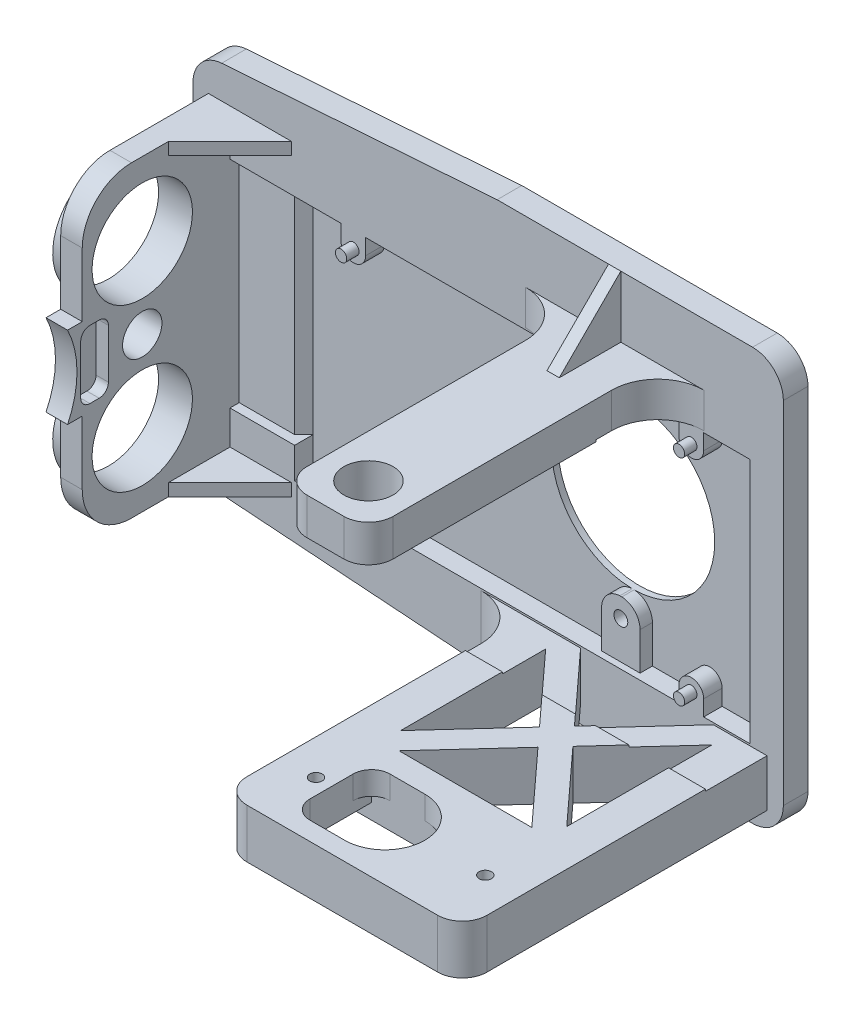
from build123d import *

# Parameters (mm, degrees)
BOSS_EXTRUDE1_START      = 1
SKETCH2_W                = 95.9
SKETCH2_H                = 67
BOSS_EXTRUDE1_DEPTH      = 4
SKETCH3_W                = 14
SKETCH3_H                = 6
BOSS_EXTRUDE2_DEPTH      = 47
SKETCH4_R                = 4
CUT_EXTRUDE1_DEPTH       = 6
SKETCH5_W                = 39
SKETCH5_H                = 8
BOSS_EXTRUDE3_DEPTH      = 49.5
SKETCH6_W                = 32.5
SKETCH6_H                = 13
CUT_EXTRUDE2_DEPTH       = 2.5
SKETCH7_W                = 22.5
SKETCH7_H                = 13
CUT_EXTRUDE3_DEPTH       = 1.75
SKETCH10_R               = 1
CUT_EXTRUDE5_DEPTH       = 5.5
FILLET1_R                = 4
SKETCH16_W               = 3.5
SKETCH16_H               = 50
BOSS_EXTRUDE5_DEPTH      = 24
BOSS_EXTRUDE6_DEPTH      = 3.5
SKETCH18_R               = 8.15
SKETCH18_R_2             = 3.2
CUT_EXTRUDE8_DEPTH       = 3.5
SKETCH19_W               = 4.5
SKETCH19_H               = 11
CUT_EXTRUDE9_DEPTH       = 2
BOSS_EXTRUDE7_START      = -5.5
SKETCH20_R               = 9.05
SKETCH20_R_2             = 8.15
SKETCH20_R_3             = 4.1
SKETCH20_R_4             = 3.2
BOSS_EXTRUDE7_DEPTH      = 5.5
FILLET2_R                = 8
CUT_EXTRUDE10_DEPTH      = 4
FILLET4_R                = 5
SKETCH23_W               = 74
SKETCH23_H               = 40
CUT_EXTRUDE12_DEPTH      = 3
SKETCH43_W               = 10.5
SKETCH43_H               = 35
CUT_EXTRUDE19_DEPTH      = 1.5
CUT_EXTRUDE20_REACH      = 115.084
SKETCH45_W               = 10
SKETCH45_H               = 40.6
SKETCH24_W               = 15.15
SKETCH24_H               = 13
CUT_EXTRUDE13_DEPTH      = 3.75
FILLET6_R                = 7.5
FILLET7_R                = 1.5
FILLET8_R                = 6.5
CUT_EXTRUDE15_DEPTH      = 10
BOSS_EXTRUDE9_DEPTH      = 3.75
BOSS_EXTRUDE10_DEPTH     = 2
SKETCH34_W               = 2
SKETCH34_H               = 10
BOSS_EXTRUDE11_DEPTH     = 10
CUT_EXTRUDE16_DEPTH      = 2
BOSS_EXTRUDE12_DEPTH     = 3
SKETCH37_R               = 0.92
BOSS_EXTRUDE13_DEPTH     = 2
SKETCH40_R               = 13.25
CUT_EXTRUDE17_DEPTH      = 1
SKETCH42_R               = 1.125
CUT_EXTRUDE18_DEPTH      = 1
CHAMFER1_SIZE            = 1.5
BOSS_EXTRUDE15_OUTLINE_R = 1.125
BOSS_EXTRUDE15_DEPTH     = 2


# Read off the part's stored shape, not the designer's step: Boss-Extrude15
# Some blends are built 0.0001 mm under size
with BuildPart() as part:
    # Sketch2 → Boss-Extrude1 (new body)
    with BuildSketch(Plane.XY.offset(BOSS_EXTRUDE1_START)):
        with Locations((-20.55, 0)):
            Rectangle(SKETCH2_W, SKETCH2_H)
    extrude(amount=BOSS_EXTRUDE1_DEPTH)

    # Sketch3 → Boss-Extrude2 (add)
    with BuildSketch(Plane.XY.offset(5)):
        with Locations((0, 20.5)):
            Rectangle(SKETCH3_W, SKETCH3_H)
    extrude(amount=BOSS_EXTRUDE2_DEPTH)

    # Sketch4 → Cut-Extrude1 (cut)
    with BuildSketch(Plane(origin=(0, 17.5, 0), x_dir=(-1, 0, 0), z_dir=(0, -1, 0))):
        with Locations(Location((0, -45, 0), (0, 0, 90))):
            Circle(SKETCH4_R)
    extrude(amount=-CUT_EXTRUDE1_DEPTH, mode=Mode.SUBTRACT)

    # Sketch5 → Boss-Extrude3 (add)
    with BuildSketch(Plane.XY.offset(5)):
        with Locations((5.25, -26.5)):
            Rectangle(SKETCH5_W, SKETCH5_H)
    extrude(amount=BOSS_EXTRUDE3_DEPTH)

    # Sketch6 → Cut-Extrude2 (cut)
    with BuildSketch(Plane.XZ.offset(30.5)):
        with Locations((5.25, 45)):
            Rectangle(SKETCH6_W, SKETCH6_H)
    extrude(amount=-CUT_EXTRUDE2_DEPTH, mode=Mode.SUBTRACT)

    # Sketch7 → Cut-Extrude3 (cut)
    with BuildSketch(Plane.XZ.offset(28)):
        with Locations((5.25, 45)):
            Rectangle(SKETCH7_W, SKETCH7_H)
    extrude(amount=-CUT_EXTRUDE3_DEPTH, mode=Mode.SUBTRACT)

    # Sketch10 → Cut-Extrude5 (cut)
    with BuildSketch(Plane.XZ.offset(28)):
        with Locations(Location((-8.525, 45, 0), (0, 0, 270))):
            Circle(SKETCH10_R)
        with Locations(Location((18.975, 45, 0), (0, 0, 270))):
            Circle(SKETCH10_R)
    extrude(amount=-CUT_EXTRUDE5_DEPTH, mode=Mode.SUBTRACT)

    # Fillet1
    fillet1_edges = [part.edges().sort_by_distance(p)[0] for p in [
        (7, 20.5, 52),
        (-7, 20.5, 52),
        (24.75, -26.5, 54.5),
        (-14.25, -26.5, 54.5),
    ]]
    fillet(fillet1_edges, radius=FILLET1_R)

    # Sketch16 → Boss-Extrude5 (add)
    with BuildSketch(Plane.XY.offset(5)):
        with Locations((-64.25, 0)):
            Rectangle(SKETCH16_W, SKETCH16_H)
    extrude(amount=BOSS_EXTRUDE5_DEPTH)

    # Sketch17 → Boss-Extrude6 (add)
    with BuildSketch(Plane.ZY.offset(66)):
        with BuildLine():
            Line((31.383389779, 6.641568045), (29, 6.641568045))
            Line((29, 6.641568045), (29, -6.641568045))
            Line((29, -6.641568045), (31.383389779, -6.641568045))
            ThreePointArc((31.383389779, -6.641568045), (29.85, 0), (31.383389779, 6.641568045))
        make_face()
    extrude(amount=-BOSS_EXTRUDE6_DEPTH)

    # Sketch18 → Cut-Extrude8 (cut)
    with BuildSketch(Plane.ZY.offset(66)):
        with Locations((19.25, -13.15)):
            Circle(SKETCH18_R)
        with Locations((19.25, 13.15)):
            Circle(SKETCH18_R)
        with Locations((19.25, 0)):
            Circle(SKETCH18_R_2)
    extrude(amount=-CUT_EXTRUDE8_DEPTH, mode=Mode.SUBTRACT)

    # Sketch19 → Cut-Extrude9 (cut)
    with BuildSketch(Plane(origin=(-62.5, 0, 0), x_dir=(0, 0, -1), z_dir=(1, 0, 0))):
        with Locations((-27, 0)):
            Rectangle(SKETCH19_W, SKETCH19_H)
    extrude(amount=-CUT_EXTRUDE9_DEPTH, mode=Mode.SUBTRACT)

    # Sketch20 → Boss-Extrude7 (add)
    # profile 1 of 7: a face of its own
    with BuildSketch(Plane(origin=(-62.5, 0, 0), x_dir=(0, 0, -1), z_dir=(1, 0, 0)).offset(BOSS_EXTRUDE7_START)):
        with Locations((-19.25, -13.15)):
            Circle(SKETCH20_R)
        with Locations(Location((-19.25, -13.15, 0), (0, 0, 270))):
            Circle(SKETCH20_R_2, mode=Mode.SUBTRACT)
    # profile 2 of 7: a face of its own
    with BuildSketch(Plane(origin=(-62.5, 0, 0), x_dir=(0, 0, -1), z_dir=(1, 0, 0)).offset(BOSS_EXTRUDE7_START)):
        with BuildLine():
            Line((-20.902631516, -3.752173913), (-20.902631516, -4.252173913))
            ThreePointArc((-20.902631516, -4.252173913), (-20.079811398, -4.138123778), (-19.25, -4.1))
            ThreePointArc((-19.25, -4.1), (-20.094419018, -4.01210126), (-20.902631516, -3.752173913))
        make_face()
    # profile 3 of 7: a face of its own
    with BuildSketch(Plane(origin=(-62.5, 0, 0), x_dir=(0, 0, -1), z_dir=(1, 0, 0)).offset(BOSS_EXTRUDE7_START)):
        with BuildLine():
            ThreePointArc((-17.597368484, -3.752173913), (-18.405580982, -4.01210126), (-19.25, -4.1))
            ThreePointArc((-19.25, -4.1), (-18.420188602, -4.138123778), (-17.597368484, -4.252173913))
            Line((-17.597368484, -4.252173913), (-17.597368484, -3.752173913))
        make_face()
    # profile 4 of 7: a face of its own
    with BuildSketch(Plane(origin=(-62.5, 0, 0), x_dir=(0, 0, -1), z_dir=(1, 0, 0)).offset(BOSS_EXTRUDE7_START)):
        with Locations((-19.25, 0)):
            Circle(SKETCH20_R_3)
        with Locations(Location((-19.25, 0, 0), (0, 0, 270))):
            Circle(SKETCH20_R_4, mode=Mode.SUBTRACT)
    # profile 5 of 7: a face of its own
    with BuildSketch(Plane(origin=(-62.5, 0, 0), x_dir=(0, 0, -1), z_dir=(1, 0, 0)).offset(BOSS_EXTRUDE7_START)):
        with BuildLine():
            Line((-20.902631516, 4.252173913), (-20.902631516, 3.752173913))
            ThreePointArc((-20.902631516, 3.752173913), (-20.09441903, 4.012101258), (-19.250000025, 4.1))
            ThreePointArc((-19.250000025, 4.1), (-20.07981141, 4.138123779), (-20.902631516, 4.252173913))
        make_face()
    # profile 6 of 7: a face of its own
    with BuildSketch(Plane(origin=(-62.5, 0, 0), x_dir=(0, 0, -1), z_dir=(1, 0, 0)).offset(BOSS_EXTRUDE7_START)):
        with BuildLine():
            ThreePointArc((-17.597368484, 4.252173913), (-18.420188614, 4.138123777), (-19.250000025, 4.1))
            ThreePointArc((-19.250000025, 4.1), (-18.405580994, 4.012101263), (-17.597368484, 3.752173913))
            Line((-17.597368484, 3.752173913), (-17.597368484, 4.252173913))
        make_face()
    # profile 7 of 7: a face of its own
    with BuildSketch(Plane(origin=(-62.5, 0, 0), x_dir=(0, 0, -1), z_dir=(1, 0, 0)).offset(BOSS_EXTRUDE7_START)):
        with Locations((-19.25, 13.15)):
            Circle(SKETCH20_R)
        with Locations(Location((-19.25, 13.15, 0), (0, 0, 270))):
            Circle(SKETCH20_R_2, mode=Mode.SUBTRACT)
    extrude(amount=BOSS_EXTRUDE7_DEPTH)

    # Fillet2
    fillet2_edges = [part.edges().sort_by_distance(p)[0] for p in [
        (-64.25, 25, 29),
        (-64.25, -25, 29),
    ]]
    fillet(fillet2_edges, radius=FILLET2_R)

    # Sketch21 → Cut-Extrude10 (cut)
    with BuildSketch(Plane.XY.offset(5)):
        Polygon((-68.5, 30), (-19.1, 33.5), (-68.5, 33.5), align=None)
        Polygon((-68.5, -30), (-19.1, -33.5), (-68.5, -33.5), align=None)
    extrude(amount=-CUT_EXTRUDE10_DEPTH, mode=Mode.SUBTRACT)

    # Fillet4
    fillet4_edges = [part.edges().sort_by_distance(p)[0] for p in [
        (-68.5, 30, 3),
        (-68.5, -30, 3),
        (27.4, -33.5, 3),
        (27.4, 33.5, 3),
    ]]
    fillet(fillet4_edges, radius=FILLET4_R)

    # Sketch23 → Cut-Extrude12 (cut)
    with BuildSketch(Plane.XY.offset(5)):
        with Locations((-15, -2.5)):
            Rectangle(SKETCH23_W, SKETCH23_H)
    extrude(amount=-CUT_EXTRUDE12_DEPTH, mode=Mode.SUBTRACT)

    # Sketch43 → Cut-Extrude19 (cut)
    with BuildSketch(Plane.XY.offset(5)):
        with Locations((-57.25, 0)):
            Rectangle(SKETCH43_W, SKETCH43_H)
    extrude(amount=-CUT_EXTRUDE19_DEPTH, mode=Mode.SUBTRACT)

    # Cut-Extrude20: up to this face of the body (flat: up to its plane)
    cut_extrude20_end = Plane(part.part.faces().sort_by_distance((-14.25, -26.5, 27.75))[0])
    # Sketch45 → Cut-Extrude20 (cut, up to the picked face)
    with BuildSketch(Plane(origin=(24.75, 0, 0), x_dir=(0, 0, -1), z_dir=(1, 0, 0)), mode=Mode.PRIVATE) as cut_extrude20_sk1:
        with Locations((-10, -2.5)):
            Rectangle(SKETCH45_W, SKETCH45_H)
    cut_extrude20_tool1 = split(extrude(cut_extrude20_sk1.sketch, amount=-CUT_EXTRUDE20_REACH, mode=Mode.PRIVATE), bisect_by=cut_extrude20_end, keep=Keep.BOTH, mode=Mode.PRIVATE)
    add(cut_extrude20_tool1.solids().sort_by(Axis((24.75, -2.5, 10), (-1, 0, 0)))[0], mode=Mode.SUBTRACT)

    # Sketch24 → Cut-Extrude13 (cut)
    with BuildSketch(Plane.XZ.offset(26.25)):
        with Locations((1.575, 45)):
            Rectangle(SKETCH24_W, SKETCH24_H)
    extrude(amount=-CUT_EXTRUDE13_DEPTH, mode=Mode.SUBTRACT)

    # Fillet6
    fillet6_edges = [part.edges().sort_by_distance(p)[0] for p in [
        (-7, 20.65, 5),
        (-14.25, -26.65, 5),
        (7, 20.65, 5),
    ]]
    fillet(fillet6_edges, radius=FILLET6_R)

    # Fillet7
    fillet7_edges = [part.edges().sort_by_distance(p)[0] for p in [
        (-63.5, 5.5, 24.75),
        (-63.5, -5.5, 24.75),
        (-63.5, -5.5, 29.25),
        (-63.5, 5.5, 29.25),
    ]]
    fillet(fillet7_edges, radius=FILLET7_R)

    # Fillet8
    # the kernel refuses this fillet: 6.5 mm, written as the material it adds along each edge
    with BuildSketch(Plane(origin=(9.15, -26.25, 51.5), x_dir=(-1, 0, 0), z_dir=(0, 1, 0))) as fillet8_piece_1:
        with BuildLine():
            CenterArc((FILLET8_R, -FILLET8_R), FILLET8_R, 90, 90)
            Line((0, -FILLET8_R), (0, 0))
            Line((0, 0), (FILLET8_R, 0))
        make_face()
    extrude(amount=3.75)
    with BuildSketch(Plane(origin=(9.15, -26.25, 38.5), x_dir=(-1, 0, 0), z_dir=(0, 1, 0))) as fillet8_piece_2:
        with BuildLine():
            CenterArc((FILLET8_R, FILLET8_R), FILLET8_R, 180, 90)
            Line((0, FILLET8_R), (0, 0))
            Line((0, 0), (FILLET8_R, 0))
        make_face()
    extrude(amount=3.75)

    # Sketch31 → Cut-Extrude15 (cut)
    with BuildSketch(Plane.XZ.offset(30.5)):
        Polygon((-8.25, 31.537731563), (-8.25, 7.962268437), (2.538771261, 19.75), align=None)
        Polygon((-5.538771261, 34.5), (5.25, 22.712268437), (16.038771261, 34.5), align=None)
        Polygon((18.75, 31.537731563), (7.961228739, 19.75), (18.75, 7.962268437), align=None)
        Polygon((5.25, 16.787731563), (-5.538771261, 5), (16.038771261, 5), align=None)
    extrude(amount=-CUT_EXTRUDE15_DEPTH, mode=Mode.SUBTRACT)

    # Sketch32 → Boss-Extrude9 (add)
    with BuildSketch(Plane.XZ.offset(26.25)):
        with BuildLine():
            ThreePointArc((-3, 38.5), (-5.121320344, 39.378679656), (-6, 41.5))
            Line((-6, 41.5), (-6, 38.5))
            Line((-6, 38.5), (-3, 38.5))
        make_face()
        with BuildLine():
            ThreePointArc((-6, 48.5), (-5.121320344, 50.621320344), (-3, 51.5))
            Line((-3, 51.5), (-6, 51.5))
            Line((-6, 51.5), (-6, 48.5))
        make_face()
    extrude(amount=-BOSS_EXTRUDE9_DEPTH)

    # Sketch33 → Boss-Extrude10 (add)
    with BuildSketch(Plane(origin=(0, 25, 0), x_dir=(1, 0, 0), z_dir=(0, 1, 0))):
        Polygon((-62.5, -5), (-62.5, -15), (-52.5, -5), align=None)
    boss_extrude10 = extrude(amount=-BOSS_EXTRUDE10_DEPTH)

    # Mirror1: Boss-Extrude10 across plane
    add(boss_extrude10.mirror(Plane.ZX))

    # Sketch34 → Boss-Extrude11 (add)
    with BuildSketch(Plane(origin=(0, 23.5, 0), x_dir=(1, 0, 0), z_dir=(0, 1, 0))):
        with Locations((0, -10)):
            Rectangle(SKETCH34_W, SKETCH34_H)
    extrude(amount=BOSS_EXTRUDE11_DEPTH)

    # Sketch35 → Cut-Extrude16 (cut)
    with BuildSketch(Plane.ZY.offset(1)):
        Polygon((5, 33.5), (15, 23.5), (15, 33.5), align=None)
    extrude(amount=-CUT_EXTRUDE16_DEPTH, mode=Mode.SUBTRACT)

    # Sketch36 → Boss-Extrude12 (add)
    with BuildSketch(Plane.XY.offset(2)):
        with BuildLine():
            Line((14.45, 14.95), (14.45, 17.5))
            Line((14.45, 17.5), (10.45, 17.5))
            Line((10.45, 17.5), (10.45, 14.95))
            ThreePointArc((10.45, 14.95), (12.45, 12.95), (14.45, 14.95))
        make_face()
        with BuildLine():
            Line((10.45, -22.5), (14.45, -22.5))
            Line((14.45, -22.5), (14.45, -19.95))
            ThreePointArc((14.45, -19.95), (12.45, -17.95), (10.45, -19.95))
            Line((10.45, -19.95), (10.45, -22.5))
        make_face()
        with BuildLine():
            Line((-40.45, 14.95), (-40.45, 17.5))
            Line((-40.45, 17.5), (-44.45, 17.5))
            Line((-44.45, 17.5), (-44.45, 14.95))
            ThreePointArc((-44.45, 14.95), (-42.45, 12.95), (-40.45, 14.95))
        make_face()
        with BuildLine():
            Line((-44.45, -22.5), (-40.45, -22.5))
            Line((-40.45, -22.5), (-40.45, -19.95))
            ThreePointArc((-40.45, -19.95), (-42.45, -17.95), (-44.45, -19.95))
            Line((-44.45, -19.95), (-44.45, -22.5))
        make_face()
    extrude(amount=BOSS_EXTRUDE12_DEPTH)

    # Sketch37 → Boss-Extrude13 (add)
    with BuildSketch(Plane.XY.offset(5)):
        with Locations((12.45, 14.95)):
            Circle(SKETCH37_R)
        with Locations(Location((12.45, -19.95, 0), (0, 0, 180))):
            Circle(SKETCH37_R)
        with Locations((-42.45, -19.95)):
            Circle(SKETCH37_R)
        with Locations(Location((-42.45, 14.95, 0), (0, 0, 180))):
            Circle(SKETCH37_R)
    extrude(amount=BOSS_EXTRUDE13_DEPTH)

    # Sketch40 → Cut-Extrude17 (cut)
    with BuildSketch(Plane.XY.offset(2)):
        Circle(SKETCH40_R)
    extrude(amount=-CUT_EXTRUDE17_DEPTH, mode=Mode.SUBTRACT)

    # Sketch42 → Cut-Extrude18 (cut)
    with BuildSketch(Plane.XY.offset(2)):
        with Locations((0, -16.375)):
            Circle(SKETCH42_R)
        with Locations((0, 16.375)):
            Circle(SKETCH42_R)
    extrude(amount=-CUT_EXTRUDE18_DEPTH, mode=Mode.SUBTRACT)

    # Chamfer1
    chamfer1_edges = [part.edges().sort_by_distance(p)[0] for p in [
        (-52, 0, 3.5),
    ]]
    chamfer(chamfer1_edges, length=CHAMFER1_SIZE - 0.0001)  # a hair under: the kernel refuses the full size

    # Boss-Extrude15 outline → Boss-Extrude15 (add)
    # profile 1 of 2: a face of its own
    with BuildSketch(Plane.XY.offset(2)):
        with BuildLine():
            Line((3.125, -22.495), (3.125, -16.37))
            ThreePointArc((3.125, -16.37), (2.265217405, -14.217230828), (0.158974332, -13.249046274))
            ThreePointArc((0.158974332, -13.249046274), (0, -13.25), (-0.158974332, -13.249046274))
            ThreePointArc((-0.158974332, -13.249046274), (-2.265217405, -14.217230828), (-3.125, -16.37))
            Line((-3.125, -16.37), (-3.125, -22.495))
            Line((-3.125, -22.495), (3.125, -22.495))
        make_face()
        with Locations((0, -16.37)):
            Circle(BOSS_EXTRUDE15_OUTLINE_R, mode=Mode.SUBTRACT)
    # profile 2 of 2: a face of its own
    with BuildSketch(Plane.XY.offset(2)):
        with BuildLine():
            ThreePointArc((-3.125, 16.37), (-2.265217405, 14.217230828), (-0.158974332, 13.249046274))
            ThreePointArc((-0.158974332, 13.249046274), (0, 13.25), (0.158974332, 13.249046274))
            ThreePointArc((0.158974332, 13.249046274), (2.265217405, 14.217230828), (3.125, 16.37))
            Line((3.125, 16.37), (3.125, 17.5))
            Line((3.125, 17.5), (-3.125, 17.5))
            Line((-3.125, 17.5), (-3.125, 16.37))
        make_face()
        with Locations((0, 16.37)):
            Circle(BOSS_EXTRUDE15_OUTLINE_R, mode=Mode.SUBTRACT)
    extrude(amount=BOSS_EXTRUDE15_DEPTH)


solid = part.part
